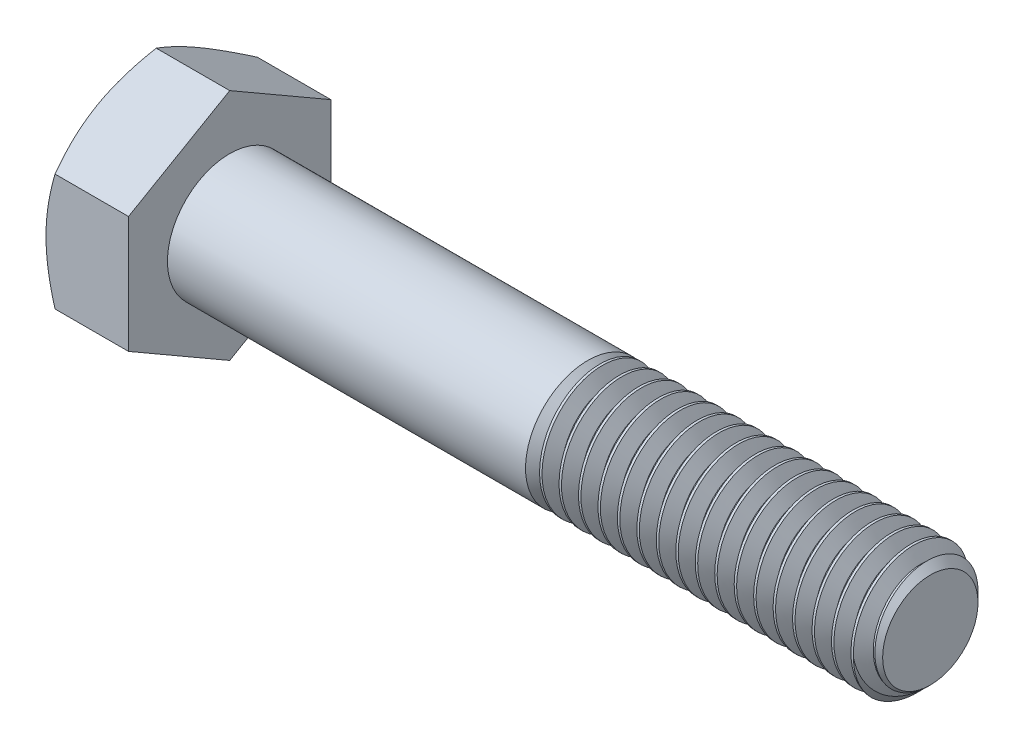
from build123d import *

# Parameters (mm, degrees)
SKETCH2_R           = 4
BOSS_EXTRUDE1_DEPTH = 45
CHAMFER1_SIZE       = 0.9375
CUT_SWEEP1_PITCH    = 1.25
BOSS_EXTRUDE2_DEPTH = 5.3
SKETCH6_OUTSIDE_W   = 206.886
SKETCH6_OUTSIDE_H   = 208.898
SKETCH6_OUTSIDE_R   = 6.5
CUT_EXTRUDE1_DEPTH  = 52.270589486
CUT_EXTRUDE1_DRAFT  = -60
SKETCH7_W           = 0.197562976
SKETCH7_H           = 0.197562976
CUT_EXTRUDE2_DEPTH  = 0.25


with BuildPart() as part:
    # Sketch2 → Boss-Extrude1 (new body)
    with BuildSketch(Plane(origin=(25.15, 0, 0), x_dir=(0, 0, -1), z_dir=(1, 0, 0))):
        Circle(SKETCH2_R)
    extrude(amount=-BOSS_EXTRUDE1_DEPTH)

    # Chamfer1
    chamfer1_edges = [part.edges().sort_by_distance(p)[0] for p in [
        (25.15, 0, 4),
    ]]
    chamfer(chamfer1_edges, length=CHAMFER1_SIZE)

    # Cut-Sweep1: the profile of Sketch5 profile screwed along a right-hand helix of 37 turns, 8 arcs to a turn; built about Z, then put on its axis
    cut_sweep1_z = Axis((0, 0, 0), (0, 0, 1))
    cut_sweep1_corners = [(4.0003, 0, 0.000173205), (3.188101184, 0, -0.46875), (3.188101184, 0, -0.625), (4.0003, 0, -1.093923205)]
    with BuildLine(mode=Mode.PRIVATE) as cut_sweep1_profile:
        Line(cut_sweep1_corners[0], cut_sweep1_corners[1])
        Line(cut_sweep1_corners[1], cut_sweep1_corners[2])
        Line(cut_sweep1_corners[2], cut_sweep1_corners[3])
        Line(cut_sweep1_corners[3], cut_sweep1_corners[0])
    cut_sweep1_cap = Face(cut_sweep1_profile.wire())
    cut_sweep1_turn_angles = [0, 22.5, 45, 67.5, 90, 112.5, 135, 157.5, 180, 202.5, 225, 247.5, 270, 292.5, 315, 337.5, 360]
    cut_sweep1_turn_weights = [1, 0.9238795325112867, 1, 0.9238795325112867, 1, 0.9238795325112867, 1, 0.9238795325112867, 1, 0.9238795325112867, 1, 0.9238795325112867, 1, 0.9238795325112867, 1, 0.9238795325112867, 1]
    cut_sweep1_turn_rails = [Edge.make_bspline([Vector(p[0], p[1], 0).rotate(cut_sweep1_z, cut_sweep1_turn_angles[k]) / cut_sweep1_turn_weights[k] + Vector(0, 0, p[2] + CUT_SWEEP1_PITCH * cut_sweep1_turn_angles[k] / 360) for k in range(17)], [0, 0, 0, 1, 1, 2, 2, 3, 3, 4, 4, 5, 5, 6, 6, 7, 7, 8, 8, 8], 2, cut_sweep1_turn_weights) for p in cut_sweep1_corners]
    cut_sweep1_turn_sides = [Face.make_surface_from_curves(cut_sweep1_turn_rails[p[0]], cut_sweep1_turn_rails[p[1]]) for p in [(0, 1), (1, 2), (2, 3), (3, 0)]]
    cut_sweep1 = Plane(origin=(25.15, 0, 0), x_dir=(0, 1, 0), z_dir=(-1, 0, 0)) * Solid(Shell([*[p.moved(Location((0, 0, CUT_SWEEP1_PITCH * i))) for i in range(37) for p in cut_sweep1_turn_sides], cut_sweep1_cap, cut_sweep1_cap.rotate(cut_sweep1_z, 13320).moved(Location((0, 0, CUT_SWEEP1_PITCH * 13320 / 360)))]))
    add(cut_sweep1, mode=Mode.SUBTRACT)

    # Sketch3 → Boss-Extrude2 (add)
    with BuildSketch(Plane.ZY.offset(19.85)):
        Polygon((-6.5, -3.75277675), (0, -7.505553499), (6.5, -3.75277675), (6.5, 3.75277675), (0, 7.505553499), (-6.5, 3.75277675), align=None)
    extrude(amount=BOSS_EXTRUDE2_DEPTH)


with BuildPart() as cut_extrude1_tool:
    # Sketch6 outside → Cut-Extrude1 (with draft: the straight prism first)
    with BuildSketch(Plane.ZY.offset(25.15)):
        Rectangle(SKETCH6_OUTSIDE_W, SKETCH6_OUTSIDE_H)
        Circle(SKETCH6_OUTSIDE_R, mode=Mode.SUBTRACT)
    extrude(amount=-CUT_EXTRUDE1_DEPTH)
    # Cut-Extrude1: the draft: its side faces are tilted about the plane it starts from
    cut_extrude1_sides = [cut_extrude1_tool.faces().sort_by_distance(p)[0] for p in [
        (0.985294743, -104.449, 0),
        (0.985294743, 0, 103.443),
        (0.985294743, 104.449, 0),
        (0.985294743, 0, -103.443),
        (0.985294743, 0, -6.5),
    ]]
    draft(cut_extrude1_sides, Plane.ZY.offset(25.15), CUT_EXTRUDE1_DRAFT)


with BuildPart() as part_1:
    add(part.part)

    # Cut-Extrude1: cut by cut_extrude1_tool
    add(cut_extrude1_tool.part, mode=Mode.SUBTRACT)

    # Sketch7 → Cut-Extrude2 (cut)
    # profile 1 of 4: a face of its own
    with BuildSketch(Plane.ZY.offset(25.15)):
        with BuildLine():
            Line((-1.284159342, 3.25), (-1.481722318, 3.25))
            Line((-1.481722318, 3.25), (-1.481722318, 4.450812462))
            add(Edge.make_bspline(
                [(-1.481722318, 4.450812462), (-1.493098012, 4.439842005), (-1.516741144, 4.417041113), (-1.556707362, 4.384772156), (-1.601314769, 4.352066201), (-1.649984109, 4.320615769), (-1.699594268, 4.291008578), (-1.7475361, 4.264381463), (-1.793009194, 4.241848462), (-1.822962567, 4.229527328), (-1.837335675, 4.22361504)],
                knots=[0, 0, 0, 0, 0.893362401, 1.856755847, 2.901947673, 4.020460078, 5.132200827, 6.168787962, 7.121294059, 8, 8, 8, 8], degree=3))
            Line((-1.837335675, 4.22361504), (-1.837335675, 4.405743408))
            add(Edge.make_bspline(
                [(-1.837335675, 4.405743408), (-1.812648378, 4.418457416), (-1.763991177, 4.443515971), (-1.695249075, 4.486795542), (-1.631070927, 4.533712378), (-1.572519137, 4.584256092), (-1.520031188, 4.635920841), (-1.475798832, 4.688052602), (-1.438788011, 4.73874045), (-1.42021898, 4.774089603), (-1.411340508, 4.790991211)],
                knots=[0, 0, 0, 0, 1.141258006, 2.249351951, 3.335817539, 4.406819942, 5.426913362, 6.360259544, 7.215985427, 8, 8, 8, 8], degree=3))
            Line((-1.411340508, 4.790991211), (-1.284159342, 4.790991211))
            Line((-1.284159342, 4.790991211), (-1.284159342, 3.25))
        make_face()
    # profile 2 of 4: a face of its own
    with BuildSketch(Plane.ZY.offset(25.15)):
        with BuildLine():
            add(Edge.make_bspline(
                [(-0.790251903, 4.010000072), (-0.790052858, 4.032022251), (-0.789663013, 4.075154426), (-0.787244933, 4.138264546), (-0.783023159, 4.198197614), (-0.776721214, 4.25490158), (-0.769258531, 4.308504437), (-0.759556995, 4.358929689), (-0.748641356, 4.406290471), (-0.735544549, 4.450537418), (-0.721155446, 4.492050974), (-0.704830549, 4.530764541), (-0.686462825, 4.566637074), (-0.666954934, 4.60004059), (-0.645279941, 4.630455529), (-0.622746104, 4.658735457), (-0.597715799, 4.683843239), (-0.57122984, 4.706424902), (-0.542898213, 4.726351902), (-0.512870822, 4.743546501), (-0.481263204, 4.758728091), (-0.447472952, 4.770156788), (-0.412201546, 4.779473599), (-0.375177484, 4.786327159), (-0.336359967, 4.790367563), (-0.309833651, 4.79078098), (-0.296344464, 4.790991211)],
                knots=[0, 0, 0, 0, 1.514747001, 2.966751498, 4.343369068, 5.64627492, 6.890416844, 8.064737671, 9.177176366, 10.232018008, 11.237056675, 12.19799043, 13.119080079, 14.007588942, 14.855863561, 15.685992447, 16.491747269, 17.290132607, 18.077525251, 18.870243746, 19.668095604, 20.485086593, 21.319398728, 22.175900658, 23.072407314, 24, 24, 24, 24], degree=3))
            add(Edge.make_bspline(
                [(-0.296344464, 4.790991211), (-0.276554072, 4.790409387), (-0.237675053, 4.789266372), (-0.180911485, 4.779944144), (-0.127415481, 4.763997036), (-0.077221797, 4.742483699), (-0.031188485, 4.715157621), (0.009921203, 4.68193861), (0.045663832, 4.643175459), (0.075649327, 4.598408838), (0.101859643, 4.548873708), (0.125144312, 4.494347738), (0.146192977, 4.43489203), (0.161129567, 4.381670872), (0.171783825, 4.335728479), (0.178836097, 4.297836494), (0.184690897, 4.256950828), (0.189176465, 4.213170395), (0.192856768, 4.166544299), (0.195698897, 4.11704351), (0.197141568, 4.064544309), (0.197419873, 4.028522328), (0.197562976, 4.010000072)],
                knots=[0, 0, 0, 0, 1.134486744, 2.228744715, 3.287356444, 4.328707449, 5.352829806, 6.347195599, 7.349461267, 8.364207941, 9.428085653, 10.559314403, 11.761222316, 13.04268526, 13.726896727, 14.465273606, 15.252205015, 16.094778733, 16.988606776, 17.934225168, 18.937792761, 20, 20, 20, 20], degree=3))
            add(Edge.make_bspline(
                [(0.197562976, 4.010000072), (0.197360203, 3.988081335), (0.196964045, 3.945258767), (0.194610758, 3.882654684), (0.190134593, 3.823173782), (0.184626591, 3.766679807), (0.176294137, 3.713323573), (0.167315467, 3.662878383), (0.156211069, 3.615573301), (0.143254845, 3.571387596), (0.128663193, 3.53008763), (0.11266119, 3.49136128), (0.094937435, 3.455235008), (0.074964401, 3.422061172), (0.053655947, 3.391399446), (0.03085601, 3.363134809), (0.006081205, 3.337674071), (-0.020643434, 3.315160142), (-0.048776137, 3.294879764), (-0.07887653, 3.277515404), (-0.110812868, 3.263129332), (-0.144371773, 3.250829956), (-0.179893749, 3.241817695), (-0.217098671, 3.234918949), (-0.256123623, 3.230856468), (-0.282752541, 3.230450776), (-0.296344464, 3.230243702)],
                knots=[0, 0, 0, 0, 1.508974709, 2.94807912, 4.311757619, 5.615040294, 6.854280449, 8.028314546, 9.141715822, 10.197470207, 11.196696834, 12.155719058, 13.080757287, 13.963948316, 14.818758719, 15.649605906, 16.461113142, 17.260189315, 18.052359509, 18.845763934, 19.647754795, 20.461145776, 21.303032214, 22.167241874, 23.064524267, 24, 24, 24, 24], degree=3))
            add(Edge.make_bspline(
                [(-0.296344464, 3.230243702), (-0.31416505, 3.230752036), (-0.348910289, 3.231743145), (-0.399653148, 3.238477126), (-0.447278028, 3.250329248), (-0.492186617, 3.266224614), (-0.533874131, 3.287485582), (-0.572539611, 3.313353701), (-0.608960011, 3.343227122), (-0.629925808, 3.366796566), (-0.64053621, 3.378724626)],
                knots=[0, 0, 0, 0, 1.10322584, 2.150986741, 3.161425019, 4.136713905, 5.093944212, 6.049774532, 7.013026876, 8, 8, 8, 8], degree=3))
            add(Edge.make_bspline(
                [(-0.64053621, 3.378724626), (-0.652749028, 3.396341795), (-0.677932381, 3.432669151), (-0.707407312, 3.494610663), (-0.733699472, 3.56279957), (-0.754333998, 3.638573732), (-0.770495975, 3.721330072), (-0.782168957, 3.811230974), (-0.788774716, 3.908237599), (-0.789748392, 3.975313505), (-0.790251903, 4.010000072)],
                knots=[0, 0, 0, 0, 0.779365345, 1.607084704, 2.489375761, 3.438383567, 4.461919411, 5.557722155, 6.737039282, 8, 8, 8, 8], degree=3))
        make_face()
        with BuildLine():
            add(Edge.make_bspline(
                [(-0.592688927, 4.010617457), (-0.592492763, 3.980978591), (-0.592117261, 3.924243246), (-0.588194178, 3.843187016), (-0.581440751, 3.770063233), (-0.57251228, 3.704973141), (-0.560723083, 3.647828693), (-0.545920352, 3.59877551), (-0.529234153, 3.557224843), (-0.508585298, 3.52369168), (-0.485977083, 3.496357261), (-0.462635646, 3.472848776), (-0.438011843, 3.452867102), (-0.412266343, 3.436206461), (-0.384999685, 3.423592119), (-0.356510025, 3.414449215), (-0.326791165, 3.409187614), (-0.30655127, 3.408431621), (-0.296344464, 3.408050381)],
                knots=[0, 0, 0, 0, 1.89448813, 3.626469325, 5.185477471, 6.587276848, 7.82441448, 8.910550357, 9.859733512, 10.6775885, 11.416198291, 12.123144072, 12.791880183, 13.439617036, 14.078171869, 14.70637855, 15.347637704, 16, 16, 16, 16], degree=3))
            add(Edge.make_bspline(
                [(-0.296344464, 3.408050381), (-0.286140213, 3.408439952), (-0.265905387, 3.409212463), (-0.236117858, 3.41435804), (-0.207739045, 3.423971614), (-0.180513042, 3.436541403), (-0.154580415, 3.452822298), (-0.130077548, 3.472879447), (-0.106613153, 3.496373973), (-0.084106493, 3.524026105), (-0.063614954, 3.557714303), (-0.046615742, 3.599231123), (-0.032043703, 3.648370213), (-0.020189817, 3.705485547), (-0.011224514, 3.770472726), (-0.00451192, 3.843393697), (-0.000562582, 3.924345633), (-0.000193277, 3.980978457), (0, 4.010617457)],
                knots=[0, 0, 0, 0, 0.652509534, 1.29391342, 1.924290653, 2.562989607, 3.207355802, 3.876242846, 4.583348185, 5.32723334, 6.150888545, 7.094226006, 8.186903555, 9.424320409, 10.81992305, 12.379283064, 14.105084285, 16, 16, 16, 16], degree=3))
            add(Edge.make_bspline(
                [(0, 4.010617457), (-0.000187089, 4.039639765), (-0.000545544, 4.095245408), (-0.00459674, 4.174740087), (-0.010945329, 4.246636517), (-0.01962919, 4.31100098), (-0.03117004, 4.3677636), (-0.045167517, 4.417045216), (-0.061847603, 4.458740728), (-0.081680166, 4.493268967), (-0.103757778, 4.52159149), (-0.126819935, 4.546107098), (-0.151443196, 4.566956825), (-0.178063809, 4.583682782), (-0.205823744, 4.597176663), (-0.235360851, 4.606463495), (-0.266384805, 4.612169035), (-0.287676143, 4.612842166), (-0.298505309, 4.613184533)],
                knots=[0, 0, 0, 0, 1.850066095, 3.544656626, 5.0727657, 6.45041401, 7.682899467, 8.762389858, 9.712573485, 10.538438529, 11.291566246, 11.996865408, 12.681389046, 13.341983376, 13.996294293, 14.643563182, 15.31009126, 16, 16, 16, 16], degree=3))
            add(Edge.make_bspline(
                [(-0.298505309, 4.613184533), (-0.308711474, 4.612916661), (-0.328836725, 4.612388453), (-0.358302727, 4.607346709), (-0.386227312, 4.59891579), (-0.412930404, 4.587495291), (-0.437745374, 4.572125556), (-0.461656324, 4.554180295), (-0.483543356, 4.532315999), (-0.49673229, 4.515970592), (-0.503476896, 4.507611818)],
                knots=[0, 0, 0, 0, 1.021318143, 2.013908504, 2.982026795, 3.937174072, 4.91255697, 5.897578595, 6.924855925, 8, 8, 8, 8], degree=3))
            add(Edge.make_bspline(
                [(-0.503476896, 4.507611818), (-0.510819714, 4.495335366), (-0.5263262, 4.469410087), (-0.543677057, 4.424350882), (-0.559004117, 4.372856788), (-0.57162337, 4.31413553), (-0.580752514, 4.24828784), (-0.58795962, 4.175390186), (-0.591703443, 4.095340795), (-0.592351369, 4.039637751), (-0.592688927, 4.010617457)],
                knots=[0, 0, 0, 0, 0.671104906, 1.417232262, 2.260109084, 3.195198885, 4.23592645, 5.382417421, 6.636286093, 8, 8, 8, 8], degree=3))
        make_face(mode=Mode.SUBTRACT)
    # profile 3 of 4: a face of its own
    with BuildSketch(Plane.ZY.offset(25.15)):
        with Locations((0.592688927, 3.348781488)):
            Rectangle(SKETCH7_W, SKETCH7_H)
    # profile 4 of 4: a face of its own
    with BuildSketch(Plane.ZY.offset(25.15)):
        with BuildLine():
            Line((1.007571176, 3.625369654), (1.205134152, 3.645125952))
            add(Edge.make_bspline(
                [(1.205134152, 3.645125952), (1.206920239, 3.635003602), (1.210372897, 3.615436243), (1.218164458, 3.587549402), (1.226067012, 3.561547623), (1.236268145, 3.538010165), (1.246891881, 3.516297683), (1.258922971, 3.496627755), (1.272575767, 3.479395444), (1.291855309, 3.459202247), (1.319210172, 3.438130304), (1.357127719, 3.421061208), (1.398840582, 3.40958445), (1.428236664, 3.408573426), (1.443444492, 3.408050381)],
                knots=[0, 0, 0, 0, 0.994516507, 1.922484754, 2.80151264, 3.623050913, 4.402748861, 5.140924173, 5.850441436, 6.526872911, 7.841975818, 9.161260782, 10.53140107, 12, 12, 12, 12], degree=3))
            add(Edge.make_bspline(
                [(1.443444492, 3.408050381), (1.456751488, 3.408529578), (1.482941721, 3.409472712), (1.521127946, 3.416783962), (1.557442454, 3.428496432), (1.591253108, 3.445301374), (1.622436856, 3.46575252), (1.649674808, 3.4900526), (1.673330676, 3.517155041), (1.692759492, 3.548382253), (1.709342511, 3.58404897), (1.725011258, 3.6246088), (1.739833634, 3.670760517), (1.753006889, 3.721915473), (1.764802895, 3.776206092), (1.773081217, 3.832402208), (1.778174547, 3.88941128), (1.778719417, 3.927774463), (1.778992858, 3.947026874)],
                knots=[0, 0, 0, 0, 0.897794352, 1.766998465, 2.614902619, 3.466100941, 4.308008728, 5.124841802, 5.922729683, 6.728261092, 7.598214292, 8.574707161, 9.662086263, 10.868425066, 12.139522319, 13.41071447, 14.70057738, 16, 16, 16, 16], degree=3))
            add(Edge.make_bspline(
                [(1.778992858, 3.947026874), (1.778899344, 3.952274865), (1.778675616, 3.964830375), (1.778290769, 3.977382036), (1.778066782, 3.984687316)],
                knots=[0, 0, 0, 0, 0.835966126, 2, 2, 2, 2], degree=3))
            add(Edge.make_bspline(
                [(1.778066782, 3.984687316), (1.768542584, 3.97022413), (1.749509536, 3.941321063), (1.714445959, 3.902529649), (1.674332612, 3.868121138), (1.629778386, 3.838362715), (1.58188343, 3.813940569), (1.531480967, 3.796194448), (1.479005485, 3.785236452), (1.443291513, 3.784030076), (1.425231655, 3.783420035)],
                knots=[0, 0, 0, 0, 0.978840568, 1.956103883, 2.947027447, 3.962820877, 4.980997961, 5.980964245, 6.979013046, 8, 8, 8, 8], degree=3))
            add(Edge.make_bspline(
                [(1.425231655, 3.783420035), (1.410181713, 3.783809962), (1.380555612, 3.784577542), (1.337158587, 3.791399547), (1.295419155, 3.801630137), (1.255732843, 3.817119745), (1.21748219, 3.836276405), (1.181068826, 3.859789736), (1.146436643, 3.887627733), (1.114033143, 3.919443767), (1.084462099, 3.9549069), (1.05838385, 3.993153184), (1.036728508, 4.03436963), (1.018710514, 4.078041798), (1.004807734, 4.124591649), (0.995147123, 4.173910112), (0.988649898, 4.225808926), (0.98809691, 4.261357846), (0.987814879, 4.279488319)],
                knots=[0, 0, 0, 0, 0.975490236, 1.920271282, 2.842894855, 3.757591483, 4.67685385, 5.613562631, 6.563069669, 7.554119451, 8.55387214, 9.553424333, 10.550567425, 11.568071726, 12.613215376, 13.695622473, 14.824733476, 16, 16, 16, 16], degree=3))
            add(Edge.make_bspline(
                [(0.987814879, 4.279488319), (0.988237289, 4.298232953), (0.989063596, 4.334900708), (0.995305351, 4.38851352), (1.005631769, 4.439304987), (1.020691426, 4.487178163), (1.039315186, 4.532440645), (1.062799025, 4.574766099), (1.090238676, 4.614335583), (1.12179809, 4.650767612), (1.1564816, 4.683457226), (1.193305446, 4.712633275), (1.232749472, 4.736615849), (1.274057373, 4.756611333), (1.317541757, 4.772064144), (1.363128302, 4.783233279), (1.410943155, 4.789786979), (1.443527149, 4.790584988), (1.460113868, 4.790991211)],
                knots=[0, 0, 0, 0, 1.151671969, 2.252870106, 3.311924673, 4.331900944, 5.332425074, 6.314476151, 7.300265758, 8.286521684, 9.270545387, 10.225535917, 11.167946231, 12.101233205, 13.04124339, 13.998220545, 14.981004193, 16, 16, 16, 16], degree=3))
            add(Edge.make_bspline(
                [(1.460113868, 4.790991211), (1.472160605, 4.79074757), (1.49610549, 4.790263292), (1.53174045, 4.786565994), (1.56653158, 4.779901008), (1.600705712, 4.771487923), (1.633686425, 4.759809927), (1.666109474, 4.746305519), (1.697583789, 4.729788608), (1.728292766, 4.711006809), (1.758043531, 4.690290273), (1.78541595, 4.666489215), (1.811504082, 4.641230711), (1.835777069, 4.613722031), (1.857467159, 4.583538628), (1.878046883, 4.551747632), (1.896524197, 4.517655353), (1.913374225, 4.481215619), (1.928371403, 4.441678329), (1.940882807, 4.398169752), (1.951607872, 4.350539191), (1.960537546, 4.298723511), (1.967159045, 4.242759655), (1.972032081, 4.182730793), (1.975222249, 4.118591267), (1.975491252, 4.074417814), (1.975629758, 4.051673513)],
                knots=[0, 0, 0, 0, 0.850689348, 1.69088598, 2.526071361, 3.350886897, 4.173587108, 4.994166539, 5.82944675, 6.680632524, 7.535501428, 8.385942454, 9.238956306, 10.098905971, 10.972410977, 11.861345628, 12.77184846, 13.708225841, 14.694799433, 15.754852217, 16.902446579, 18.141290626, 19.466225842, 20.880733292, 22.39393263, 24, 24, 24, 24], degree=3))
            add(Edge.make_bspline(
                [(1.975629758, 4.051673513), (1.975490325, 4.027900399), (1.975218576, 3.981567557), (1.972003363, 3.913933366), (1.967132776, 3.849998865), (1.960506598, 3.789722069), (1.951514674, 3.733194972), (1.940827057, 3.680427456), (1.928222834, 3.631322105), (1.913411036, 3.585874606), (1.896572884, 3.543562676), (1.878123243, 3.503865304), (1.857460667, 3.466841197), (1.834817321, 3.432419349), (1.81048396, 3.400539597), (1.784080657, 3.371287341), (1.755598839, 3.344751007), (1.725401557, 3.320631953), (1.69353413, 3.29937701), (1.660430384, 3.280622167), (1.625716723, 3.265258667), (1.589750014, 3.252655004), (1.552594169, 3.242248635), (1.513946549, 3.235236805), (1.473985704, 3.231265544), (1.446951668, 3.230587277), (1.433257651, 3.230243702)],
                knots=[0, 0, 0, 0, 1.538356107, 2.998194159, 4.380716326, 5.687456969, 6.921258146, 8.08355215, 9.170518603, 10.200253214, 11.174652363, 12.115998813, 13.031191965, 13.915860606, 14.780247615, 15.624154577, 16.462764255, 17.29681422, 18.1223677, 18.939254916, 19.756006416, 20.575278551, 21.404021733, 22.250368457, 23.113728878, 24, 24, 24, 24], degree=3))
            add(Edge.make_bspline(
                [(1.433257651, 3.230243702), (1.418732748, 3.230494839), (1.390314716, 3.230986189), (1.348827314, 3.236152771), (1.309305056, 3.244007659), (1.271862965, 3.255603334), (1.236220636, 3.269877298), (1.202986414, 3.288118612), (1.171569683, 3.309163632), (1.142358031, 3.333436747), (1.115693486, 3.360848821), (1.091567168, 3.390724272), (1.070415495, 3.423450039), (1.052349162, 3.45883318), (1.036346581, 3.496576015), (1.023940229, 3.537184652), (1.013861262, 3.58028456), (1.00970173, 3.610098607), (1.007571176, 3.625369654)],
                knots=[0, 0, 0, 0, 1.08199657, 2.11693069, 3.111083497, 4.081436044, 5.034173265, 5.967546613, 6.901297947, 7.84883568, 8.792454994, 9.747011506, 10.706361727, 11.690764787, 12.70483191, 13.757514363, 14.851376857, 16, 16, 16, 16], degree=3))
        make_face()
        with BuildLine():
            add(Edge.make_bspline(
                [(1.778066782, 4.283810009), (1.777844584, 4.296167498), (1.777412091, 4.320220558), (1.773622923, 4.355313673), (1.767526176, 4.388360963), (1.758968941, 4.419552455), (1.747347963, 4.448557507), (1.733885852, 4.47605331), (1.717423045, 4.501277762), (1.698847657, 4.524570528), (1.678386493, 4.54540537), (1.656104474, 4.563571489), (1.632419371, 4.579143971), (1.606762975, 4.59138813), (1.579978695, 4.601477273), (1.551423134, 4.608071145), (1.521489215, 4.612690284), (1.500880058, 4.613017562), (1.490365698, 4.613184533)],
                knots=[0, 0, 0, 0, 1.20361398, 2.342757417, 3.433960756, 4.474970456, 5.487648377, 6.473933575, 7.452701285, 8.415527761, 9.372491588, 10.291530068, 11.211879743, 12.12647906, 13.055739058, 13.994253148, 14.97671008, 16, 16, 16, 16], degree=3))
            add(Edge.make_bspline(
                [(1.490365698, 4.613184533), (1.479550713, 4.612856809), (1.458245164, 4.612211193), (1.427017644, 4.608053397), (1.397402188, 4.600092498), (1.36919886, 4.589532546), (1.342094419, 4.576470071), (1.317074221, 4.559354236), (1.29309033, 4.539957753), (1.271104705, 4.51745525), (1.251021561, 4.492783687), (1.233326098, 4.466174633), (1.218424276, 4.437615052), (1.206512128, 4.407224018), (1.19677715, 4.375266419), (1.190089912, 4.341456506), (1.18597516, 4.305830273), (1.185579924, 4.281454958), (1.185377855, 4.268992786)],
                knots=[0, 0, 0, 0, 1.007165334, 1.984118292, 2.925321257, 3.856078893, 4.785899085, 5.718627206, 6.671847665, 7.654235469, 8.641842333, 9.630378272, 10.624608936, 11.635186472, 12.665777387, 13.731187195, 14.840042241, 16, 16, 16, 16], degree=3))
            add(Edge.make_bspline(
                [(1.185377855, 4.268992786), (1.185564481, 4.25786364), (1.185930382, 4.23604371), (1.190287864, 4.204199511), (1.196100099, 4.173807131), (1.2053659, 4.145176801), (1.216528497, 4.117892863), (1.231036441, 4.092581934), (1.247371005, 4.068487167), (1.266510109, 4.04641574), (1.287668429, 4.026393087), (1.31077761, 4.008941189), (1.335545758, 3.994002062), (1.36220298, 3.981978182), (1.390589415, 3.972718025), (1.420641701, 3.965900682), (1.452490468, 3.961840104), (1.474301842, 3.961433897), (1.485426624, 3.961226713)],
                knots=[0, 0, 0, 0, 1.102204012, 2.160993585, 3.181057555, 4.164839289, 5.138418409, 6.097303793, 7.050641095, 8.019669129, 8.986440483, 9.932879371, 10.884360123, 11.847412593, 12.824617322, 13.839006415, 14.897795988, 16, 16, 16, 16], degree=3))
            add(Edge.make_bspline(
                [(1.485426624, 3.961226713), (1.495831895, 3.961435921), (1.516311795, 3.961847691), (1.546312698, 3.965925579), (1.574819195, 3.972755565), (1.601959278, 3.982041219), (1.627688956, 3.994060942), (1.651835213, 4.009118787), (1.674864814, 4.026371256), (1.696102673, 4.046529924), (1.715513299, 4.068849511), (1.732299881, 4.093550515), (1.746634721, 4.12018436), (1.7579177, 4.149066744), (1.76695483, 4.179842075), (1.773317571, 4.212705196), (1.777484418, 4.247585953), (1.777869725, 4.271552704), (1.778066782, 4.283810009)],
                knots=[0, 0, 0, 0, 1.017004716, 2.00169281, 2.953445817, 3.879374072, 4.80207141, 5.723561102, 6.657273834, 7.611045633, 8.581233951, 9.544037932, 10.525327521, 11.53237926, 12.57032081, 13.657564536, 14.802009319, 16, 16, 16, 16], degree=3))
        make_face(mode=Mode.SUBTRACT)
    extrude(amount=-CUT_EXTRUDE2_DEPTH, mode=Mode.SUBTRACT)

    # Sketch9 → Revolve1 (revolve)
    with BuildSketch(Plane.XY, mode=Mode.PRIVATE) as revolve1_sk:
        Polygon((-19.85, 4), (-19.85, 0), (7.15, 0), (3.15, 4), align=None)
    revolve(revolve1_sk.sketch.rotate(Axis((-19.85, 0, 0), (1, 0, 0)), 270), axis=Axis((-19.85, 0, 0), (1, 0, 0)))


solid = part_1.part
